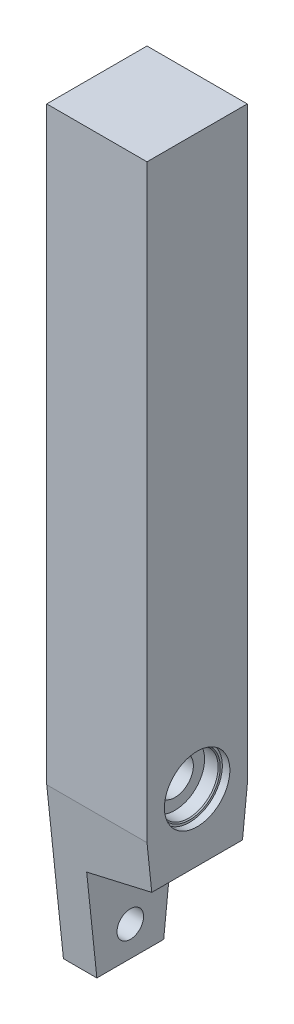
from build123d import *

# Parameters (mm, degrees)
SKETCH5_W               = 38.1
SKETCH5_H               = 298.45
BOSS_EXTRUDE2_DEPTH     = 19.05
F_3_8_CLEARANCE_HOLE2_D = 10.0838
F_3_8_CLEARANCE_HOLE4_D = 13.97
BODY_MOVE_COPY4_ANGLE   = 90
CUT_EXTRUDE1_DEPTH      = 218.574389578
CUT_EXTRUDE1_DEPTH_BACK = 218.574389578
CUT_EXTRUDE5_DEPTH      = 218.574389578
CUT_EXTRUDE5_DEPTH_BACK = 218.574389578


with BuildPart() as part:
    # Sketch5 → Boss-Extrude2 (new, symmetric)
    with BuildSketch(Plane.XY):
        with Locations((0, 66.675)):
            Rectangle(SKETCH5_W, SKETCH5_H)
    extrude(amount=BOSS_EXTRUDE2_DEPTH, both=True)

    # 3/8 Clearance Hole2 (through all)
    with Locations(Plane(origin=(19.05, 0, 0), x_dir=(0, 0, -1), z_dir=(1, 0, 0))):
        with Locations((0, -57.15)):
            Hole(F_3_8_CLEARANCE_HOLE2_D / 2)

    # 3/8 Clearance Hole4 (through all)
    with Locations(Plane(origin=(19.05, 0, 0), x_dir=(0, 0, -1), z_dir=(1, 0, 0))):
        with Locations((0, 0)):
            Hole(F_3_8_CLEARANCE_HOLE4_D / 2)


with BuildPart() as body_2:
    # uxcell-FR6ZZ: read off the stored shape, not the designer's step
    # uxcell-FR6ZZ outline → uxcell-FR6ZZ (revolve)
    with BuildSketch(Plane(origin=(46.870492888, 0, -67.456601715), x_dir=(1, 0, 0), z_dir=(0, 0, 1))):
        Polygon((12.430125, 146.229545606), (4.7625, 146.229545606), (4.7625, 137.815795606), (11.2395, 137.815795606), (11.2395, 142.975170606), (11.636375, 143.372045606), (12.430125, 143.372045606), align=None)
    revolve(axis=Axis((46.870492888, 0, -67.456601715), (0, 1, 0)))


with BuildPart() as body_2_1:
    # Body-Move/Copy4: read off the stored shape, not the designer's step
    # Body-Move/Copy4: moved
    add(body_2.part.moved(Location((-46.8704929, -127.1795456, 67.4566017))).rotate(Axis((0, 0, 0), (0, 0, -1)), BODY_MOVE_COPY4_ANGLE))


with BuildPart() as body_3:
    # Mirror1: mirrored copy
    add(body_2_1.part.mirror(Plane(origin=(0, 0, 0), x_dir=(0, 0, 1), z_dir=(1, 0, 0))))


with BuildPart() as part_1:
    add(part.part)

    # Combine2: cut body 3, body 2
    add(body_3.part, mode=Mode.SUBTRACT)
    add(body_2_1.part, mode=Mode.SUBTRACT)

    # Sketch11 → Cut-Extrude1 (cut, two sides: drawn at the far end of the back side and taken through both)
    with BuildSketch(Plane.XY.offset(-CUT_EXTRUDE1_DEPTH_BACK)):
        Polygon((-6.35, -691.607801887), (-6.35, -82.55), (-6.35, -31.75), (19.05, -25.4), (609.922858655, 122.318214664), (1581.067185153, -612.994182394), (964.794326498, -1426.920198945), align=None)
    extrude(amount=CUT_EXTRUDE1_DEPTH + CUT_EXTRUDE1_DEPTH_BACK, mode=Mode.SUBTRACT)

    # Sketch18 → Cut-Extrude5 (cut, two sides: drawn at the far end of the back side and taken through both)
    with BuildSketch(Plane(origin=(0, 0, 0), x_dir=(0, 0, -1), z_dir=(1, 0, 0)).offset(-CUT_EXTRUDE5_DEPTH_BACK)):
        Polygon((-67.601886726, 453.814659538), (-19.05, -8.125685716), (-12.7, -68.5419), (12.7, -68.5419), (19.05, -8.125685716), (67.601886726, 453.814659538), (67.601886726, -475.155024096), (-67.601886726, -475.155024096), align=None)
    extrude(amount=CUT_EXTRUDE5_DEPTH + CUT_EXTRUDE5_DEPTH_BACK, mode=Mode.SUBTRACT)


solid = part_1.part
